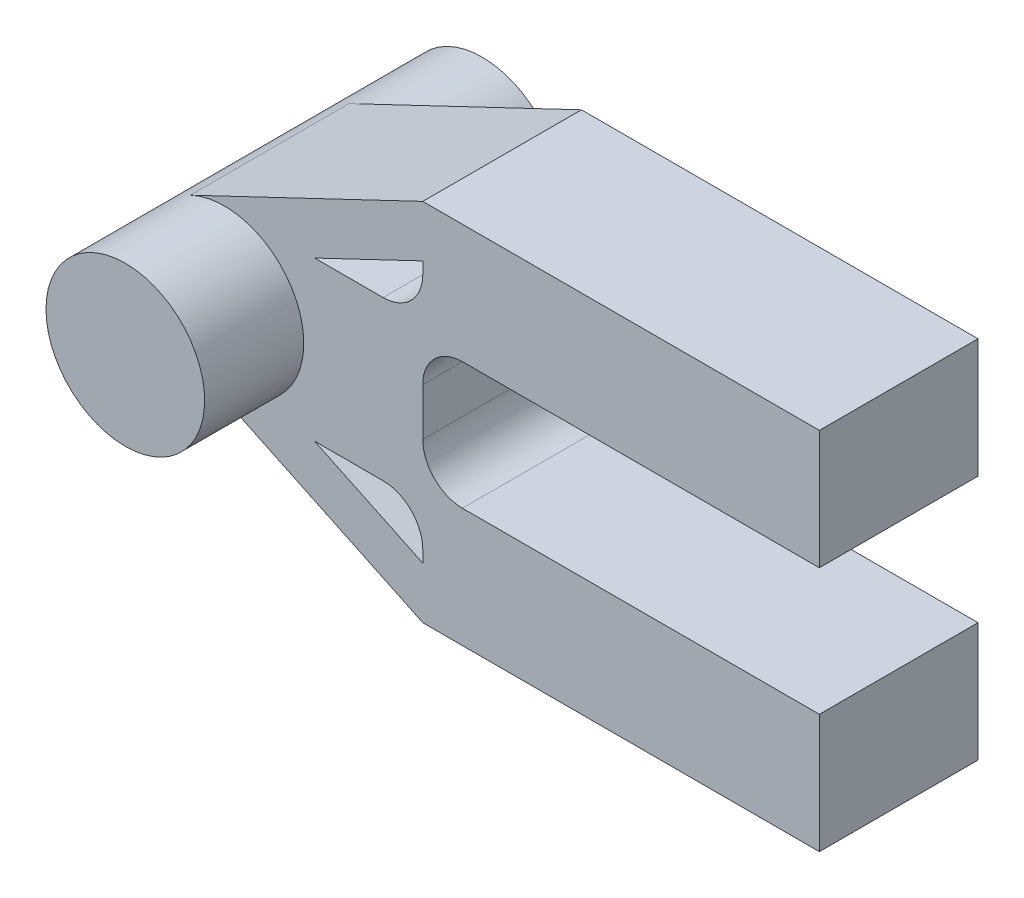
from build123d import *

# Parameters (mm, degrees)
SKETCH_1_R      = 20
EXTRUDE_1_DEPTH = 65
SKETCH_2_W      = 40
SKETCH_2_H      = 40
EXTRUDE_2_DEPTH = 50
SKETCH_3_W      = 100
SKETCH_3_H      = 30
EXTRUDE_3_DEPTH = 40
EXTRUDE_6_DEPTH = 20
FILLET_1_R      = 10
EXTRUDE_START   = 25
SKETCH_14_R     = 20
EXTRUDE_8_DEPTH = 25


with BuildPart() as part:
    # 스케치1 → 보스-돌출1 (new body)
    with BuildSketch(Plane.XY):
        Circle(SKETCH_1_R)
    extrude(amount=EXTRUDE_1_DEPTH)

    # 스케치2 → 보스-돌출2 (add)
    with BuildSketch(Plane(origin=(0, 0, 0), x_dir=(0, 0, -1), z_dir=(1, 0, 0))):
        with Locations((-20, 0)):
            Rectangle(SKETCH_2_W, SKETCH_2_H)
    extrude(amount=EXTRUDE_2_DEPTH)

    # 스케치3 → 보스-돌출3 (add)
    with BuildSketch(Plane(origin=(0, 0, 0), x_dir=(-1, 0, 0), z_dir=(0, 0, -1))):
        with Locations((-100, -31)):
            Rectangle(SKETCH_3_W, SKETCH_3_H)
        with Locations((-100, 31)):
            Rectangle(SKETCH_3_W, SKETCH_3_H)
    extrude(amount=-EXTRUDE_3_DEPTH)

    # 스케치11 → 보스-돌출6 (add, symmetric)
    with BuildSketch(Plane.XY.offset(20)):
        Polygon((18.653853978, 18.052584992), (50, 33), (50, 46), (-8.608378193, 18.052584992), align=None)
        Polygon((18.653853978, -18.052584992), (50, -33), (50, -46), (-8.608378193, -18.052584992), align=None)
    extrude(amount=EXTRUDE_6_DEPTH, both=True)

    # 필렛1
    fillet_1_edges = [part.edges().sort_by_distance(p)[0] for p in [
        (50, -20, 20),
        (50, -16, 20),
        (50, 16, 20),
        (50, 20, 20),
    ]]
    fillet(fillet_1_edges, radius=FILLET_1_R)

    # 스케치14 → 보스-돌출8 (add)
    with BuildSketch(Plane(origin=(0, 0, 0), x_dir=(-1, 0, 0), z_dir=(0, 0, -1)).offset(EXTRUDE_START)):
        Circle(SKETCH_14_R)
    extrude(amount=-EXTRUDE_8_DEPTH)


solid = part.part
